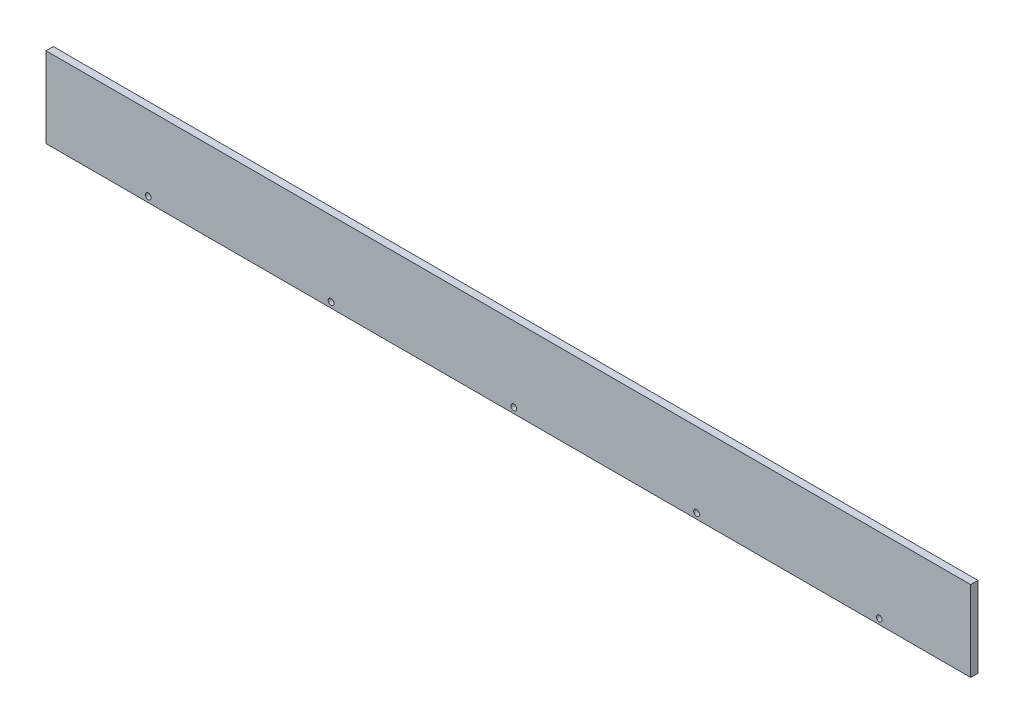
from build123d import *

# Parameters (mm, degrees)
SKETCH1_W           = 506
SKETCH1_H           = 44
SKETCH1_R           = 1.6
BOSS_EXTRUDE1_DEPTH = 4


with BuildPart() as part:
    # Sketch1 → Boss-Extrude1 (new body)
    with BuildSketch(Plane.XY):
        Rectangle(SKETCH1_W, SKETCH1_H)
        with Locations((203, -19)):
            Circle(SKETCH1_R, mode=Mode.SUBTRACT)
        with Locations((103, -19)):
            Circle(SKETCH1_R, mode=Mode.SUBTRACT)
        with Locations((3, -19)):
            Circle(SKETCH1_R, mode=Mode.SUBTRACT)
        with Locations((-97, -19)):
            Circle(SKETCH1_R, mode=Mode.SUBTRACT)
        with Locations((-197, -19)):
            Circle(SKETCH1_R, mode=Mode.SUBTRACT)
    extrude(amount=BOSS_EXTRUDE1_DEPTH)


solid = part.part
